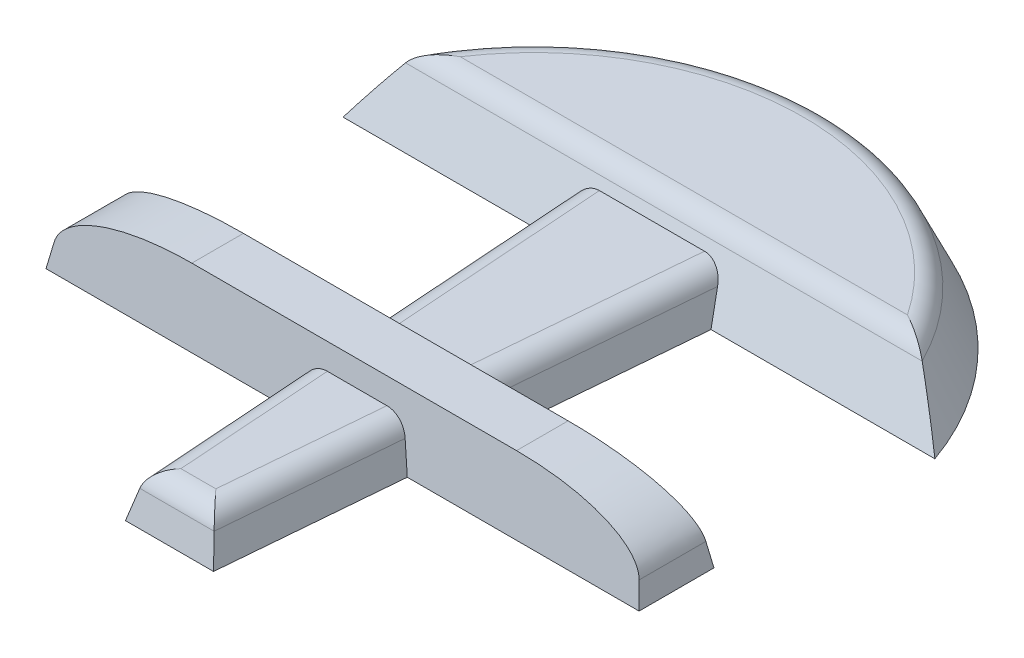
from build123d import *

# Parameters (mm, degrees)
BOSS_EXTRUDE1_DEPTH = 2
BOSS_EXTRUDE1_TAPER = 15
FILLET1_R           = 1
BOSS_EXTRUDE2_DEPTH = 3
BOSS_EXTRUDE2_DRAFT = 25
FILLET2_R           = 1
SKETCH4_W           = 26.928933456
SKETCH4_H           = 3.399397771
BOSS_EXTRUDE3_DEPTH = 3
BOSS_EXTRUDE3_TAPER = 10
FILLET3_START       = 3.548118457
FILLET3_DEPTH       = 3.399397771


with BuildPart() as part:
    # Sketch2 → Boss-Extrude1 (new body)
    with BuildSketch(Plane(origin=(0, 0, 0), x_dir=(1, 0, 0), z_dir=(0, 1, 0))):
        Polygon((2.245194627, -15.051216937), (4.446052988, 10.654239994), (-3.553947012, 10.654239994), (-1.754805373, -15.051216937), align=None)
    extrude(amount=BOSS_EXTRUDE1_DEPTH, taper=BOSS_EXTRUDE1_TAPER)

    # Fillet1
    fillet1_edges = [part.edges().sort_by_distance(p)[0] for p in [
        (2.807764808, 2, 2.198488472),
        (0.441540754, 2, -10.118341609),
        (-2.117166811, 2, 2.198488472),
        (0.249057243, 2, 14.515318552),
    ]]
    fillet(fillet1_edges, radius=FILLET1_R)


with BuildPart() as boss_extrude2_tool:
    # Sketch3 → Boss-Extrude2 (with draft: the straight prism first)
    with BuildSketch(Plane(origin=(0, 0, 0), x_dir=(1, 0, 0), z_dir=(0, 1, 0))):
        with BuildLine():
            Line((-12.679718033, 5.755185759), (14.192118481, 5.755185759))
            ThreePointArc((14.192118481, 5.755185759), (0.756200224, 15.248268586), (-12.679718033, 5.755185759))
        make_face()
    extrude(amount=BOSS_EXTRUDE2_DEPTH)
    # Boss-Extrude2: the draft: its side faces are tilted about the plane it starts from
    boss_extrude2_sides = [boss_extrude2_tool.faces().sort_by_distance(p)[0] for p in [
        (0.756200224, 1.5, -5.755185759),
        (0.756200224, 1.5, -15.248268586),
    ]]
    draft(boss_extrude2_sides, Plane(origin=(0, 0, 0), x_dir=(1, 0, 0), z_dir=(0, 1, 0)), BOSS_EXTRUDE2_DRAFT)


with BuildPart() as part_1:
    add(part.part)

    # Boss-Extrude2: add boss_extrude2_tool
    add(boss_extrude2_tool.part)

    # Fillet2
    fillet2_edges = [part_1.edges().sort_by_distance(p)[0] for p in [
        (0.756200224, 3, -7.154108734),
        (0.756200224, 3, -13.849345612),
    ]]
    fillet(fillet2_edges, radius=FILLET2_R)

    # Sketch4 → Boss-Extrude3 (add)
    with BuildSketch(Plane(origin=(0, 0, 0), x_dir=(1, 0, 0), z_dir=(0, 1, 0))):
        with Locations((0, -5.247817343)):
            Rectangle(SKETCH4_W, SKETCH4_H)
    extrude(amount=BOSS_EXTRUDE3_DEPTH, taper=BOSS_EXTRUDE3_TAPER)

    # Fillet3: read off the stored shape, not the designer's step
    # Fillet3 outline → Fillet3 (cut)
    with BuildSketch(Plane.XY.offset(FILLET3_START)):
        with BuildLine():
            Line((12.935485786, 3), (7.371907057, 3))
            add(Edge.make_bspline(
                [(7.371907057, 3), (12.935485786, 3), (13.280753575, 1.041889066)],
                knots=[0, 0, 0, 1, 1, 1], degree=2, weights=[1, 0.766044443, 1]))
            Line((13.280753575, 1.041889066), (12.935485786, 3))
        make_face()
        with BuildLine():
            add(Edge.make_bspline(
                [(-7.371907057, 3), (-12.935485786, 3), (-13.280753575, 1.041889066)],
                knots=[0, 0, 0, 1, 1, 1], degree=2, weights=[1, 0.766044443, 1]))
            Line((-7.371907057, 3), (-12.935485786, 3))
            Line((-12.935485786, 3), (-13.280753575, 1.041889066))
        make_face()
    extrude(amount=FILLET3_DEPTH, mode=Mode.SUBTRACT)


solid = part_1.part
